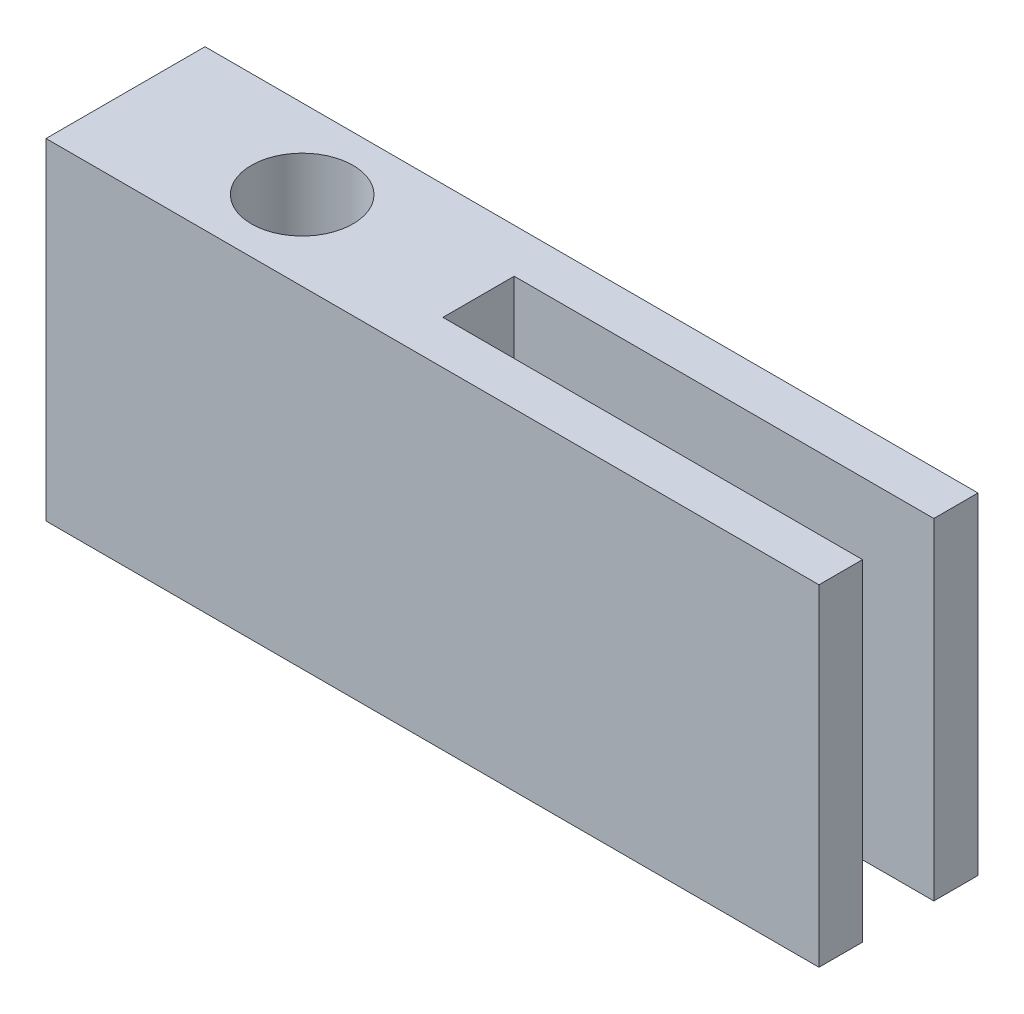
from build123d import *

# Parameters (mm, degrees)
SKETCH1_R           = 1.15
BOSS_EXTRUDE2_DEPTH = 7.5


with BuildPart() as part:
    # Sketch1 → Boss-Extrude2 (new body)
    with BuildSketch(Plane(origin=(0, 0, 0), x_dir=(1, 0, 0), z_dir=(0, 1, 0))):
        Polygon((17.5, 3.6), (0, 3.6), (0, 0), (17.5, 0), (17.5, 0.986331657), (8, 0.986331657), (8, 2.6), (17.5, 2.6), align=None)
        with Locations((4, 1.8)):
            Circle(SKETCH1_R, mode=Mode.SUBTRACT)
    extrude(amount=BOSS_EXTRUDE2_DEPTH)


solid = part.part
